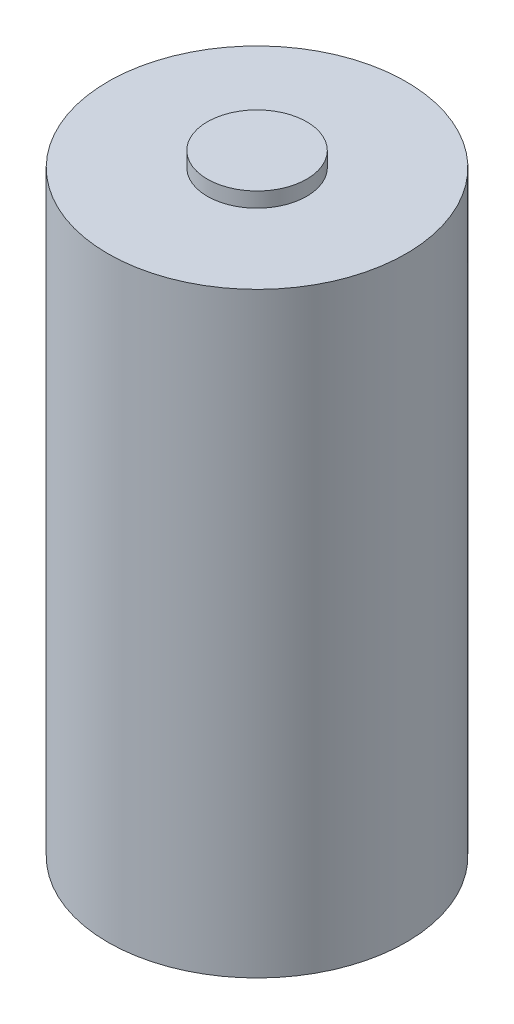
from build123d import *

# Parameters (mm, degrees)
SKETCH2_R           = 3
BOSS_EXTRUDE1_DEPTH = 12
SKETCH3_R           = 1
BOSS_EXTRUDE2_DEPTH = 0.3


with BuildPart() as part:
    # Sketch2 → Boss-Extrude1 (new body)
    with BuildSketch(Plane(origin=(0, 0, 0), x_dir=(1, 0, 0), z_dir=(0, 1, 0))):
        Circle(SKETCH2_R)
    extrude(amount=BOSS_EXTRUDE1_DEPTH)

    # Sketch3 → Boss-Extrude2 (add)
    with BuildSketch(Plane(origin=(0, 12, 0), x_dir=(1, 0, 0), z_dir=(0, 1, 0))):
        Circle(SKETCH3_R)
    extrude(amount=BOSS_EXTRUDE2_DEPTH)


solid = part.part
